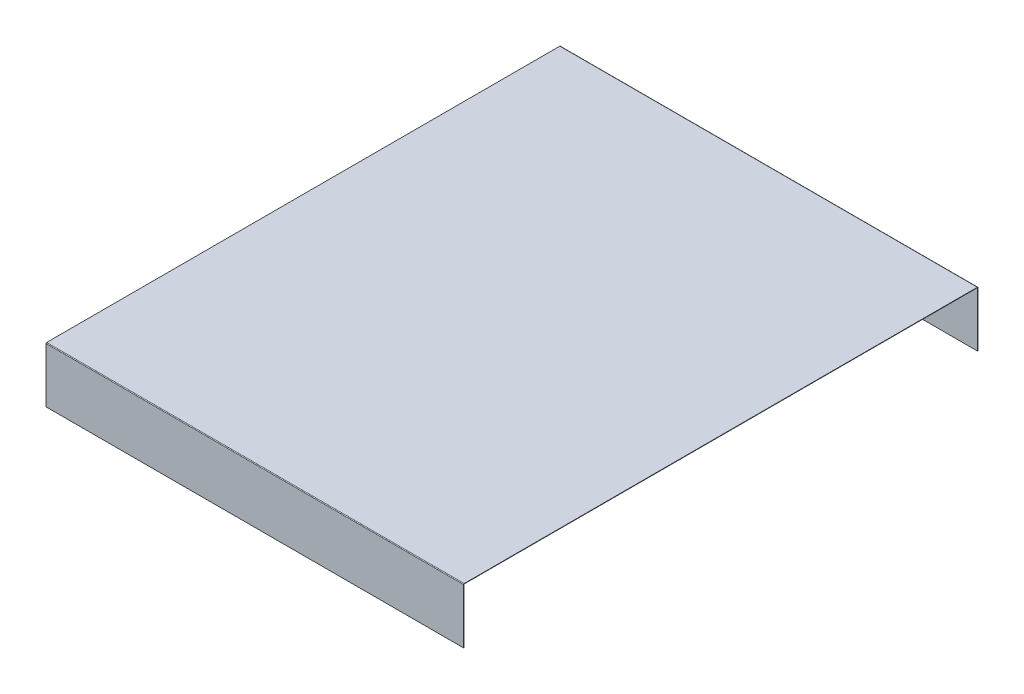
from build123d import *

# Parameters (mm, degrees)
CROQUIS1_W                         = 1220
CROQUIS1_H                         = 1503
BRIDA_BASE1_DEPTH                  = 1.214
BRIDA_DE_ARISTA1_STRIP_W           = 6.3292
BRIDA_DE_ARISTA1_STRIP_H           = 1.214
BRIDA_DE_ARISTA1_STRIP_CUT_DEPTH   = 1220
BRIDA_DE_ARISTA1_STRIP_2_W         = 6.3292
BRIDA_DE_ARISTA1_STRIP_2_H         = 1.214
BRIDA_DE_ARISTA1_STRIP_CUT_2_DEPTH = 1220
BRIDA_DE_ARISTA1_DEPTH             = 1220
BRIDA_DE_ARISTA1_BEND_DEPTH        = 1220


# Sheet-metal steps are written as plain solids
with BuildPart() as part:
    # Croquis1 → Brida base1 (new body)
    with BuildSketch(Plane(origin=(0, 0, 0), x_dir=(1, 0, 0), z_dir=(0, 1, 0))):
        with Locations((610, -751.5)):
            Rectangle(CROQUIS1_W, CROQUIS1_H)
    extrude(amount=-BRIDA_BASE1_DEPTH)

    # Brida de arista1 strip (across the edge) → Brida de arista1 strip cut (cut)
    with BuildSketch(Plane(origin=(0, -1.214, 0), x_dir=(0, 0, 1), z_dir=(1, 0, 0))):
        with Locations((-1.214, -0.607)):
            Rectangle(BRIDA_DE_ARISTA1_STRIP_W, BRIDA_DE_ARISTA1_STRIP_H)
    extrude(amount=BRIDA_DE_ARISTA1_STRIP_CUT_DEPTH, mode=Mode.SUBTRACT)

    # Brida de arista1 strip 2 (across the edge) → Brida de arista1 strip cut 2 (cut)
    with BuildSketch(Plane(origin=(1220, -1.214, 1503), x_dir=(0, 0, -1), z_dir=(-1, 0, 0))):
        with Locations((-1.214, -0.607)):
            Rectangle(BRIDA_DE_ARISTA1_STRIP_2_W, BRIDA_DE_ARISTA1_STRIP_2_H)
    extrude(amount=BRIDA_DE_ARISTA1_STRIP_CUT_2_DEPTH, mode=Mode.SUBTRACT)

    # Brida de arista1 section (across the edge) → Brida de arista1 (add)
    with BuildSketch(Plane(origin=(0, -1.214, 0), x_dir=(0, 0, 1), z_dir=(1, 0, 0))):
        with BuildLine():
            Line((0, 0.7366), (0, 160.786))
            Line((0, 160.786), (1.214, 160.786))
            Line((1.214, 160.786), (1.214, 0.7366))
            ThreePointArc((1.214, 0.7366), (1.429745145, 0.215745145), (1.9506, 0))
            Line((1.9506, 0), (1.9506, -1.214))
            ThreePointArc((1.9506, -1.214), (0.571317513, -0.642682487), (0, 0.7366))
        make_face()
    extrude(amount=BRIDA_DE_ARISTA1_DEPTH)

    # Brida de arista1 section 2 (across the edge) → Brida de arista1 bend (add)
    with BuildSketch(Plane(origin=(1220, -1.214, 1503), x_dir=(0, 0, -1), z_dir=(-1, 0, 0))):
        with BuildLine():
            Line((0, 0.7366), (0, 160.786))
            Line((0, 160.786), (1.214, 160.786))
            Line((1.214, 160.786), (1.214, 0.7366))
            ThreePointArc((1.214, 0.7366), (1.429745145, 0.215745145), (1.9506, 0))
            Line((1.9506, 0), (1.9506, -1.214))
            ThreePointArc((1.9506, -1.214), (0.571317513, -0.642682487), (0, 0.7366))
        make_face()
    extrude(amount=BRIDA_DE_ARISTA1_BEND_DEPTH)


solid = part.part
